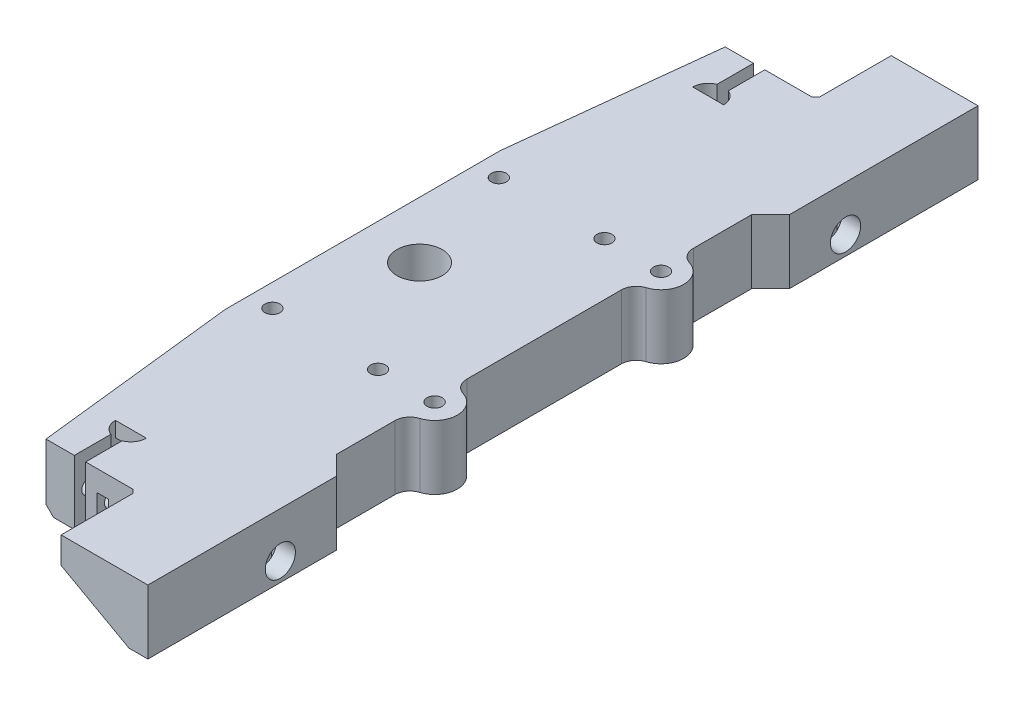
from build123d import *
from build123d.topology import SkipClean

# Parameters (mm, degrees)
SZKIC1_R                    = 2
DODANIE_WYCI_GNI_CIE1_DEPTH = 15
DODANIE_WYCI_GNI_CIE3_START = -2
DODANIE_WYCI_GNI_CIE3_DEPTH = 2
DODANIE_WYCI_GNI_CIE4_DEPTH = 15
WYTNIJ_WYCI_GNI_CIE1_DEPTH  = 15
ZAOKR_GLENIE1_R             = 4
SFAZOWANIE1_SIZE            = 2
WYTNIJ_WYCI_GNI_CIE3_START  = -7
SZKIC8_R                    = 2
WYTNIJ_WYCI_GNI_CIE3_DEPTH  = 107.031561
WYTNIJ_WYCI_GNI_CIE4_START  = 8
SZKIC9_R                    = 3.5
WYTNIJ_WYCI_GNI_CIE4_DEPTH  = 4
WYTNIJ_WYCI_GNI_CIE5_START  = -6
SZKIC10_R                   = 2
WYTNIJ_WYCI_GNI_CIE5_DEPTH  = 3
SZKIC12_W                   = 10.2
SZKIC12_H                   = 10.2
SZKIC12_W_2                 = 7.8
SZKIC12_H_2                 = 7.8
WYTNIJ_WYCI_GNI_CIE7_DEPTH  = 10
SZKIC13_R                   = 2
WYTNIJ_WYCI_GNI_CIE8_DEPTH  = 8
DODANIE_WYCI_GNI_CIE5_DEPTH = 20
SZKIC15_R                   = 5.1
WYTNIJ_WYCI_GNI_CIE9_DEPTH  = 7
SFAZOWANIE2_SIZE            = 1
SZKIC17_R                   = 2
SZKIC17_R_2                 = 6
DODANIE_WYCI_GNI_CIE6_DEPTH = 2
SZKIC18_W                   = 50
SZKIC18_H                   = 17
SZKIC18_R                   = 4
DODANIE_WYCI_GNI_CIE7_DEPTH = 5
SFAZOWANIE3_SIZE            = 5


# Some blends are built 0.0001 mm under size
with BuildPart() as part:
    # Szkic1 → Dodanie-wyciągnięcie1 (new body)
    # profile 1 of 2: a face of its own
    with BuildSketch(Plane(origin=(0, 0, 0), x_dir=(1, 0, 0), z_dir=(0, 1, 0))):
        with BuildLine():
            Line((-11.5, 0), (-20.5, 0))
            Line((-20.5, 0), (-20.5, -36.5))
            Line((-20.5, -36.5), (-14.5, -90))
            Line((-14.5, -90), (-7, -90))
            Line((-7, -90), (-7, -80.315757))
            ThreePointArc((-7, -80.315757), (-7.808679, -73.111785), (-1.4, -76.5))
            ThreePointArc((-1.4, -76.5), (-2.111785, -78.808679), (-4, -80.315757))
            Line((-4, -80.315757), (-4, -90))
            Line((-4, -90), (27.5, -90))
            Line((27.5, -90), (27.5, 0))
            Line((27.5, 0), (0.5, 0))
            ThreePointArc((0.5, 0), (-5.5, -6), (-11.5, 0))
        make_face()
        with Locations(Location((-14.5, -30, 0), (0, 0, 270))):
            Circle(SZKIC1_R, mode=Mode.SUBTRACT)
        with Locations(Location((13.5, -30, 0), (0, 0, 270))):
            Circle(SZKIC1_R, mode=Mode.SUBTRACT)
    # profile 2 of 2: a face of its own
    with BuildSketch(Plane(origin=(0, 0, 0), x_dir=(1, 0, 0), z_dir=(0, 1, 0))):
        with BuildLine():
            Line((-14.5, 90), (-20.5, 36.5))
            Line((-20.5, 36.5), (-20.5, 0))
            Line((-20.5, 0), (-11.5, 0))
            ThreePointArc((-11.5, 0), (-5.5, 6), (0.5, 0))
            Line((0.5, 0), (27.5, 0))
            Line((27.5, 0), (27.5, 90))
            Line((27.5, 90), (-4, 90))
            Line((-4, 90), (-4, 80.315757))
            ThreePointArc((-4, 80.315757), (-2.111785, 78.808679), (-1.4, 76.5))
            ThreePointArc((-1.4, 76.5), (-7.808679, 73.111785), (-7, 80.315757))
            Line((-7, 80.315757), (-7, 90))
            Line((-7, 90), (-14.5, 90))
        make_face()
        with Locations(Location((-14.5, 30, 0), (0, 0, 270))):
            Circle(SZKIC1_R, mode=Mode.SUBTRACT)
        with Locations(Location((13.5, 30, 0), (0, 0, 270))):
            Circle(SZKIC1_R, mode=Mode.SUBTRACT)
    extrude(amount=DODANIE_WYCI_GNI_CIE1_DEPTH)

    # Szkic3 → Dodanie-wyciągnięcie3 (add)
    with BuildSketch(Plane(origin=(0, 15, 0), x_dir=(1, 0, 0), z_dir=(0, 1, 0)).offset(DODANIE_WYCI_GNI_CIE3_START)):
        with BuildLine():
            ThreePointArc((-1.4, -76.5), (-5.5, -72.4), (-9.6, -76.5))
            Line((-9.6, -76.5), (-1.4, -76.5))
        make_face()
        with BuildLine():
            Line((-1.4, 76.5), (-9.6, 76.5))
            ThreePointArc((-9.6, 76.5), (-5.5, 72.4), (-1.4, 76.5))
        make_face()
    extrude(amount=DODANIE_WYCI_GNI_CIE3_DEPTH)

    # Szkic4 → Dodanie-wyciągnięcie4 (add)
    with BuildSketch(Plane(origin=(0, 15, 0), x_dir=(1, 0, 0), z_dir=(0, 1, 0))):
        with BuildLine():
            ThreePointArc((27.5, -28.267949), (29.5, -28.267949), (30.5, -30))
            ThreePointArc((30.5, -30), (29.5, -31.732051), (27.5, -31.732051))
            Line((27.5, -31.732051), (27.5, -35.91608))
            ThreePointArc((27.5, -35.91608), (32.372983, -34.582576), (34.5, -30))
            ThreePointArc((34.5, -30), (32.372983, -25.417424), (27.5, -24.08392))
            Line((27.5, -24.08392), (27.5, -28.267949))
        make_face()
        with BuildLine():
            ThreePointArc((27.5, -31.732051), (26.5, -30), (27.5, -28.267949))
            Line((27.5, -28.267949), (27.5, -24.08392))
            ThreePointArc((27.5, -24.08392), (22.5, -30), (27.5, -35.91608))
            Line((27.5, -35.91608), (27.5, -31.732051))
        make_face()
        with BuildLine():
            ThreePointArc((27.5, 35.91608), (22.5, 30), (27.5, 24.08392))
            Line((27.5, 24.08392), (27.5, 28.267949))
            ThreePointArc((27.5, 28.267949), (26.5, 30), (27.5, 31.732051))
            Line((27.5, 31.732051), (27.5, 35.91608))
        make_face()
        with BuildLine():
            Line((27.5, 28.267949), (27.5, 24.08392))
            ThreePointArc((27.5, 24.08392), (32.372983, 25.417424), (34.5, 30))
            ThreePointArc((34.5, 30), (32.372983, 34.582576), (27.5, 35.91608))
            Line((27.5, 35.91608), (27.5, 31.732051))
            ThreePointArc((27.5, 31.732051), (29.5, 31.732051), (30.5, 30))
            ThreePointArc((30.5, 30), (29.5, 28.267949), (27.5, 28.267949))
        make_face()
    extrude(amount=-DODANIE_WYCI_GNI_CIE4_DEPTH)

    # Szkic5 → Wytnij-wyciągnięcie1 (cut)
    with SkipClean():  # the faces are left unmerged after this step: merging them gives an invalid solid
        with BuildSketch(Plane(origin=(0, 15, 0), x_dir=(1, 0, 0), z_dir=(0, 1, 0))):
            with BuildLine():
                ThreePointArc((27.5, -28.267949), (30.5, -30), (27.5, -31.732051))
                Line((27.5, -31.732051), (27.5, -28.267949))
            make_face()
            with BuildLine():
                Line((27.5, -28.267949), (27.5, -31.732051))
                ThreePointArc((27.5, -31.732051), (29.5, -31.732051), (30.5, -30))
                ThreePointArc((30.5, -30), (29.5, -28.267949), (27.5, -28.267949))
            make_face()
            with BuildLine():
                ThreePointArc((27.5, -28.267949), (26.5, -30), (27.5, -31.732051))
                Line((27.5, -31.732051), (27.5, -28.267949))
            make_face()
            with BuildLine():
                Line((27.5, 31.732051), (27.5, 28.267949))
                ThreePointArc((27.5, 28.267949), (29.5, 28.267949), (30.5, 30))
                ThreePointArc((30.5, 30), (29.5, 31.732051), (27.5, 31.732051))
            make_face()
            with BuildLine():
                ThreePointArc((27.5, 31.732051), (26.5, 30), (27.5, 28.267949))
                Line((27.5, 28.267949), (27.5, 31.732051))
            make_face()
            with BuildLine():
                ThreePointArc((27.5, 31.732051), (30.5, 30), (27.5, 28.267949))
                Line((27.5, 28.267949), (27.5, 31.732051))
            make_face()
        extrude(amount=-WYTNIJ_WYCI_GNI_CIE1_DEPTH, mode=Mode.SUBTRACT)

    # Zaokrąglenie1
    zaokr_glenie1_edges = [part.edges().sort_by_distance(p)[0] for p in [
        (27.5, 7.5, -35.91608),
        (27.5, 7.5, 35.91608),
        (27.5, 7.5, 24.08392),
        (27.5, 7.5, -24.08392),
    ]]
    fillet(zaokr_glenie1_edges, radius=ZAOKR_GLENIE1_R)

    # Sfazowanie1
    sfazowanie1_edges = [part.edges().sort_by_distance(p)[0] for p in [
        (-17.5, 0, 63.25),
        (-20.5, 0, 0),
        (-17.5, 0, -63.25),
    ]]
    chamfer(sfazowanie1_edges, length=SFAZOWANIE1_SIZE)

    # Szkic8 → Wytnij-wyciągnięcie3 (cut)
    with SkipClean():  # the faces are left unmerged after this step: merging them gives an invalid solid
        with BuildSketch(Plane.ZY.offset(4).offset(WYTNIJ_WYCI_GNI_CIE3_START)):
            with Locations((86, 8)):
                Circle(SZKIC8_R)
        wytnij_wyci_gni_cie3 = extrude(amount=WYTNIJ_WYCI_GNI_CIE3_DEPTH, mode=Mode.SUBTRACT)

    # Szkic9 → Wytnij-wyciągnięcie4 (cut)
    with SkipClean():  # the faces are left unmerged after this step: merging them gives an invalid solid
        with BuildSketch(Plane.ZY.offset(4).offset(WYTNIJ_WYCI_GNI_CIE4_START)):
            with Locations((86, 8)):
                Circle(SZKIC9_R)
        wytnij_wyci_gni_cie4 = extrude(amount=WYTNIJ_WYCI_GNI_CIE4_DEPTH, mode=Mode.SUBTRACT)

    # Szkic10 → Wytnij-wyciągnięcie5 (cut)
    # profile 1 of 2: a face of its own
    with SkipClean():  # the faces are left unmerged after this step: merging them gives an invalid solid
        with BuildSketch(Plane.ZY.offset(4).offset(WYTNIJ_WYCI_GNI_CIE5_START)):
            Polygon((89, 6.267949), (89, 9.732051), (86, 11.464102), (83, 9.732051), (83, 6.267949), (86, 4.535898), align=None)
            with Locations((86, 8)):
                Circle(SZKIC10_R, mode=Mode.SUBTRACT)
        # profile 2 of 2: a face of its own
        with BuildSketch(Plane.ZY.offset(4).offset(WYTNIJ_WYCI_GNI_CIE5_START)):
            Polygon((90, 11.464102), (86, 11.464102), (89, 9.732051), (89, 6.267949), (86, 4.535898), (90, 4.535898), align=None)
        wytnij_wyci_gni_cie5 = extrude(amount=WYTNIJ_WYCI_GNI_CIE5_DEPTH, mode=Mode.SUBTRACT)

    # Lustro2: Wytnij-wyciągnięcie3, Wytnij-wyciągnięcie4, Wytnij-wyciągnięcie5 across plane
    with SkipClean():  # the faces are left unmerged after this step: merging them gives an invalid solid
        add(wytnij_wyci_gni_cie3.mirror(Plane.XY), mode=Mode.SUBTRACT)
        add(wytnij_wyci_gni_cie4.mirror(Plane.XY), mode=Mode.SUBTRACT)
        add(wytnij_wyci_gni_cie5.mirror(Plane.XY), mode=Mode.SUBTRACT)

    # Szkic12 → Wytnij-wyciągnięcie7 (cut)
    # profile 1 of 2: a face of its own
    with SkipClean():  # the faces are left unmerged after this step: merging them gives an invalid solid
        with BuildSketch(Plane.XZ):
            with Locations((22.4, 74.9)):
                Rectangle(SZKIC12_W, SZKIC12_H)
            with Locations((22.4, 74.9)):
                Rectangle(SZKIC12_W_2, SZKIC12_H_2, mode=Mode.SUBTRACT)
        # profile 2 of 2: a face of its own
        with BuildSketch(Plane.XZ):
            with Locations((22.4, -74.9)):
                Rectangle(SZKIC12_W, SZKIC12_H)
            with Locations((22.4, -74.9)):
                Rectangle(SZKIC12_W_2, SZKIC12_H_2, mode=Mode.SUBTRACT)
        extrude(amount=-WYTNIJ_WYCI_GNI_CIE7_DEPTH, mode=Mode.SUBTRACT)

    # Szkic13 → Wytnij-wyciągnięcie8 (cut)
    with SkipClean():  # the faces are left unmerged after this step: merging them gives an invalid solid
        with BuildSketch(Plane(origin=(26.3, 0, 0), x_dir=(0, 0, -1), z_dir=(1, 0, 0))):
            with Locations((74.9, 5)):
                Circle(SZKIC13_R)
            with Locations((-74.9, 5)):
                Circle(SZKIC13_R)
        extrude(amount=-WYTNIJ_WYCI_GNI_CIE8_DEPTH, mode=Mode.SUBTRACT)

    # Szkic14 → Dodanie-wyciągnięcie5 (add)
    with SkipClean():  # the faces are left unmerged after this step: merging them gives an invalid solid
        with BuildSketch(Plane(origin=(0, 0, -90), x_dir=(-1, 0, 0), z_dir=(0, 0, -1))):
            Polygon((-27.5, 15), (-27.5, 0), (-9.5, 9.977563), (-9.5, 15), align=None)
        dodanie_wyci_gni_cie5 = extrude(amount=DODANIE_WYCI_GNI_CIE5_DEPTH)

    # Szkic15 → Wytnij-wyciągnięcie9 (cut)
    with SkipClean():  # the faces are left unmerged after this step: merging them gives an invalid solid
        with BuildSketch(Plane(origin=(6.46361, 11.660661, 0), x_dir=(0.8746197071393933, -0.48480962024634155, 0), z_dir=(-0.48480962024634155, -0.8746197071393933, 0))):
            with Locations((13.371669, -100)):
                Circle(SZKIC15_R)
        wytnij_wyci_gni_cie9 = extrude(amount=-WYTNIJ_WYCI_GNI_CIE9_DEPTH, mode=Mode.SUBTRACT)

    # Lustro4: Dodanie-wyciągnięcie5, Wytnij-wyciągnięcie9 across plane
    with SkipClean():  # the faces are left unmerged after this step: merging them gives an invalid solid
        add(dodanie_wyci_gni_cie5.mirror(Plane.XY))
        add(wytnij_wyci_gni_cie9.mirror(Plane.XY), mode=Mode.SUBTRACT)

    # Sfazowanie2
    # the kernel refuses this chamfer: 1 mm, written as the material it adds along each edge
    with BuildSketch(Plane(origin=(9.5, 7.40588, -90), x_dir=(-0.999621916911297, 0, 0.0274958766105822), z_dir=(0, 1, 0))) as sfazowanie2_piece_1_section:
        Polygon((SFAZOWANIE2_SIZE * 0.999621916911, -SFAZOWANIE2_SIZE * 0.0274958766106), (-SFAZOWANIE2_SIZE * 0.0274958766106, -SFAZOWANIE2_SIZE * 0.999621916911), (0, 0), align=None)
    sfazowanie2_piece_1 = extrude(amount=7.59412, mode=Mode.PRIVATE)
    sfazowanie2_piece_1 = split(sfazowanie2_piece_1, bisect_by=Plane(origin=(8.150565, 10.725567, -90.333682), z_dir=(0.4848096202463415, 0.8746197071393933, 0)), keep=Keep.TOP, mode=Mode.PRIVATE)
    add(sfazowanie2_piece_1)
    with BuildSketch(Plane(origin=(29.749245, -1.246777, -90), x_dir=(-0.4846263219276858, -0.8742890282190773, 0.02749587661058218), z_dir=(-0.8746197071393933, 0.4848096202463415, 0))) as sfazowanie2_piece_2_section:
        Polygon((SFAZOWANIE2_SIZE * 0.999621916911, -SFAZOWANIE2_SIZE * 0.0274958766106), (-SFAZOWANIE2_SIZE * 0.0274958766106, -SFAZOWANIE2_SIZE * 0.999621916911), (0, 0), align=None)
    sfazowanie2_piece_2 = extrude(amount=25.723739, mode=Mode.PRIVATE)
    sfazowanie2_piece_2 = split(sfazowanie2_piece_2, bisect_by=Plane(origin=(18.166954, 0, -90.333808), z_dir=(0, 1, 0)), keep=Keep.TOP, mode=Mode.PRIVATE)
    sfazowanie2_piece_2 = split(sfazowanie2_piece_2, bisect_by=Plane(origin=(9.5, 4.804938, -90.333808), z_dir=(1, 0, 0)), keep=Keep.TOP, mode=Mode.PRIVATE)
    sfazowanie2_piece_2 = split(sfazowanie2_piece_2, bisect_by=Plane(origin=(27.5, 4.804938, -90.333808), z_dir=(-1, 0, 0)), keep=Keep.TOP, mode=Mode.PRIVATE)
    add(sfazowanie2_piece_2)
    with BuildSketch(Plane(origin=(29.749245, -1.246777, 90), x_dir=(-0.48462632192768573, -0.8742890282190774, -0.027495876610582216), z_dir=(-0.8746197071393933, 0.4848096202463415, 0))) as sfazowanie2_piece_3_section:
        Polygon((SFAZOWANIE2_SIZE * 0.999621916911, SFAZOWANIE2_SIZE * 0.0274958766106), (-SFAZOWANIE2_SIZE * 0.0274958766106, SFAZOWANIE2_SIZE * 0.999621916911), (0, 0), align=None)
    sfazowanie2_piece_3 = extrude(amount=25.723739, mode=Mode.PRIVATE)
    sfazowanie2_piece_3 = split(sfazowanie2_piece_3, bisect_by=Plane(origin=(18.166954, 0, 90.333808), z_dir=(0, 1, 0)), keep=Keep.TOP, mode=Mode.PRIVATE)
    sfazowanie2_piece_3 = split(sfazowanie2_piece_3, bisect_by=Plane(origin=(27.5, 4.804938, 90.333808), z_dir=(-1, 0, 0)), keep=Keep.TOP, mode=Mode.PRIVATE)
    sfazowanie2_piece_3 = split(sfazowanie2_piece_3, bisect_by=Plane(origin=(9.5, 4.804938, 90.333808), z_dir=(1, 0, 0)), keep=Keep.TOP, mode=Mode.PRIVATE)
    add(sfazowanie2_piece_3)
    with BuildSketch(Plane(origin=(9.5, 7.40588, 90), x_dir=(-0.999621916911297, 0, -0.0274958766105822), z_dir=(0, 1, 0))) as sfazowanie2_piece_4_section:
        Polygon((SFAZOWANIE2_SIZE * 0.999621916911, SFAZOWANIE2_SIZE * 0.0274958766106), (-SFAZOWANIE2_SIZE * 0.0274958766106, SFAZOWANIE2_SIZE * 0.999621916911), (0, 0), align=None)
    sfazowanie2_piece_4 = extrude(amount=7.59412, mode=Mode.PRIVATE)
    sfazowanie2_piece_4 = split(sfazowanie2_piece_4, bisect_by=Plane(origin=(8.150565, 10.725567, 90.333682), z_dir=(0.4848096202463415, 0.8746197071393933, 0)), keep=Keep.TOP, mode=Mode.PRIVATE)
    add(sfazowanie2_piece_4)
    with BuildSketch(Plane(origin=(9.5, 7.40588, -90), x_dir=(-0.999621916911297, 0, 0.0274958766105822), z_dir=(0, 1, 0))) as sfazowanie2_piece_5a_section:
        Polygon((SFAZOWANIE2_SIZE * 0.999621916911, -SFAZOWANIE2_SIZE * 0.0274958766106), (-SFAZOWANIE2_SIZE * 0.0274958766106, -SFAZOWANIE2_SIZE * 0.999621916911), (0, 0), align=None)
    sfazowanie2_piece_5a = extrude(amount=7.59412, mode=Mode.PRIVATE)
    sfazowanie2_piece_5a = split(sfazowanie2_piece_5a, bisect_by=Plane(origin=(9.742914, 9.842913, -90.322962), z_dir=(-0.4848096202463415, -0.8746197071393933, 0)), keep=Keep.TOP, mode=Mode.PRIVATE)
    with BuildSketch(Plane(origin=(29.749245, -1.246777, -90), x_dir=(-0.4846263219276858, -0.8742890282190773, 0.02749587661058218), z_dir=(-0.8746197071393933, 0.4848096202463415, 0))) as sfazowanie2_piece_5b_section:
        Polygon((SFAZOWANIE2_SIZE * 0.999621916911, -SFAZOWANIE2_SIZE * 0.0274958766106), (-SFAZOWANIE2_SIZE * 0.0274958766106, -SFAZOWANIE2_SIZE * 0.999621916911), (0, 0), align=None)
    sfazowanie2_piece_5b = extrude(amount=25.723739, mode=Mode.PRIVATE)
    sfazowanie2_piece_5b = split(sfazowanie2_piece_5b, bisect_by=Plane(origin=(9.5, 10.2553, -90.322962), z_dir=(-1, 0, 0)), keep=Keep.TOP, mode=Mode.PRIVATE)
    sfazowanie2_piece_5 = sfazowanie2_piece_5a & sfazowanie2_piece_5b
    add(sfazowanie2_piece_5)
    with BuildSketch(Plane(origin=(29.749245, -1.246777, 90), x_dir=(-0.48462632192768573, -0.8742890282190774, -0.027495876610582216), z_dir=(-0.8746197071393933, 0.4848096202463415, 0))) as sfazowanie2_piece_6a_section:
        Polygon((SFAZOWANIE2_SIZE * 0.999621916911, SFAZOWANIE2_SIZE * 0.0274958766106), (-SFAZOWANIE2_SIZE * 0.0274958766106, SFAZOWANIE2_SIZE * 0.999621916911), (0, 0), align=None)
    sfazowanie2_piece_6a = extrude(amount=25.723739, mode=Mode.PRIVATE)
    sfazowanie2_piece_6a = split(sfazowanie2_piece_6a, bisect_by=Plane(origin=(9.5, 10.2553, 90.322962), z_dir=(-1, 0, 0)), keep=Keep.TOP, mode=Mode.PRIVATE)
    with BuildSketch(Plane(origin=(9.5, 7.40588, 90), x_dir=(-0.999621916911297, 0, -0.0274958766105822), z_dir=(0, 1, 0))) as sfazowanie2_piece_6b_section:
        Polygon((SFAZOWANIE2_SIZE * 0.999621916911, SFAZOWANIE2_SIZE * 0.0274958766106), (-SFAZOWANIE2_SIZE * 0.0274958766106, SFAZOWANIE2_SIZE * 0.999621916911), (0, 0), align=None)
    sfazowanie2_piece_6b = extrude(amount=7.59412, mode=Mode.PRIVATE)
    sfazowanie2_piece_6b = split(sfazowanie2_piece_6b, bisect_by=Plane(origin=(9.742914, 9.842913, 90.322962), z_dir=(-0.4848096202463415, -0.8746197071393933, 0)), keep=Keep.TOP, mode=Mode.PRIVATE)
    sfazowanie2_piece_6 = sfazowanie2_piece_6a & sfazowanie2_piece_6b
    add(sfazowanie2_piece_6)

    # Szkic17 → Dodanie-wyciągnięcie6 (add)
    with BuildSketch(Plane(origin=(0, 15, 0), x_dir=(1, 0, 0), z_dir=(0, 1, 0))):
        with BuildLine():
            Line((27.5, -110), (27.5, -39.539392))
            ThreePointArc((27.5, -39.539392), (28.275097, -37.17296), (30.3, -35.723635))
            ThreePointArc((30.3, -35.723635), (34.5, -30), (30.3, -24.276365))
            ThreePointArc((30.3, -24.276365), (28.275097, -22.82704), (27.5, -20.460608))
            Line((27.5, -20.460608), (27.5, 20.460608))
            ThreePointArc((27.5, 20.460608), (28.275097, 22.82704), (30.3, 24.276365))
            ThreePointArc((30.3, 24.276365), (34.5, 30), (30.3, 35.723635))
            ThreePointArc((30.3, 35.723635), (28.275097, 37.17296), (27.5, 39.539392))
            Line((27.5, 39.539392), (27.5, 110))
            Line((27.5, 110), (9.5, 110))
            Line((9.5, 110), (9.5, 91))
            Line((9.5, 91), (8.5, 90))
            Line((8.5, 90), (-4, 90))
            Line((-4, 90), (-4, 80.315757))
            ThreePointArc((-4, 80.315757), (-2.111785, 78.808679), (-1.4, 76.5))
            Line((-1.4, 76.5), (-9.6, 76.5))
            ThreePointArc((-9.6, 76.5), (-8.888215, 78.808679), (-7, 80.315757))
            Line((-7, 80.315757), (-7, 90))
            Line((-7, 90), (-14.5, 90))
            Line((-14.5, 90), (-20.5, 36.5))
            Line((-20.5, 36.5), (-20.5, -36.5))
            Line((-20.5, -36.5), (-14.5, -90))
            Line((-14.5, -90), (-7, -90))
            Line((-7, -90), (-7, -80.315757))
            ThreePointArc((-7, -80.315757), (-8.888215, -78.808679), (-9.6, -76.5))
            Line((-9.6, -76.5), (-1.4, -76.5))
            ThreePointArc((-1.4, -76.5), (-2.111785, -78.808679), (-4, -80.315757))
            Line((-4, -80.315757), (-4, -90))
            Line((-4, -90), (8.5, -90))
            Line((8.5, -90), (9.5, -91))
            Line((9.5, -91), (9.5, -110))
            Line((9.5, -110), (27.5, -110))
        make_face()
        with Locations(Location((28.5, 30, 0), (0, 0, 270))):
            Circle(SZKIC17_R, mode=Mode.SUBTRACT)
        with Locations(Location((-14.5, 30, 0), (0, 0, 270))):
            Circle(SZKIC17_R, mode=Mode.SUBTRACT)
        with Locations(Location((13.5, 30, 0), (0, 0, 270))):
            Circle(SZKIC17_R, mode=Mode.SUBTRACT)
        with Locations(Location((-5.5, 0, 0), (0, 0, 270))):
            Circle(SZKIC17_R_2, mode=Mode.SUBTRACT)
        with Locations(Location((28.5, -30, 0), (0, 0, 270))):
            Circle(SZKIC17_R, mode=Mode.SUBTRACT)
        with Locations(Location((13.5, -30, 0), (0, 0, 270))):
            Circle(SZKIC17_R, mode=Mode.SUBTRACT)
        with Locations(Location((-14.5, -30, 0), (0, 0, 270))):
            Circle(SZKIC17_R, mode=Mode.SUBTRACT)
    extrude(amount=DODANIE_WYCI_GNI_CIE6_DEPTH)

    # Szkic18 → Dodanie-wyciągnięcie7 (add)
    # profile 1 of 2: a face of its own
    with BuildSketch(Plane(origin=(27.5, 0, 0), x_dir=(0, 0, -1), z_dir=(1, 0, 0))):
        with Locations((85, 8.5)):
            Rectangle(SZKIC18_W, SZKIC18_H)
        with Locations((74.9, 5)):
            Circle(SZKIC18_R, mode=Mode.SUBTRACT)
    # profile 2 of 2: a face of its own
    with BuildSketch(Plane(origin=(27.5, 0, 0), x_dir=(0, 0, -1), z_dir=(1, 0, 0))):
        with Locations((-85, 8.5)):
            Rectangle(SZKIC18_W, SZKIC18_H)
        with Locations((-74.9, 5)):
            Circle(SZKIC18_R, mode=Mode.SUBTRACT)
    extrude(amount=DODANIE_WYCI_GNI_CIE7_DEPTH)

    # Sfazowanie3
    sfazowanie3_edges = [part.edges().sort_by_distance(p)[0] for p in [
        (27.5, 7.5, -60),
        (27.5, 8.5, 60),
    ]]
    chamfer(sfazowanie3_edges, length=SFAZOWANIE3_SIZE - 0.0001)  # a hair under: the kernel refuses the full size


solid = part.part
